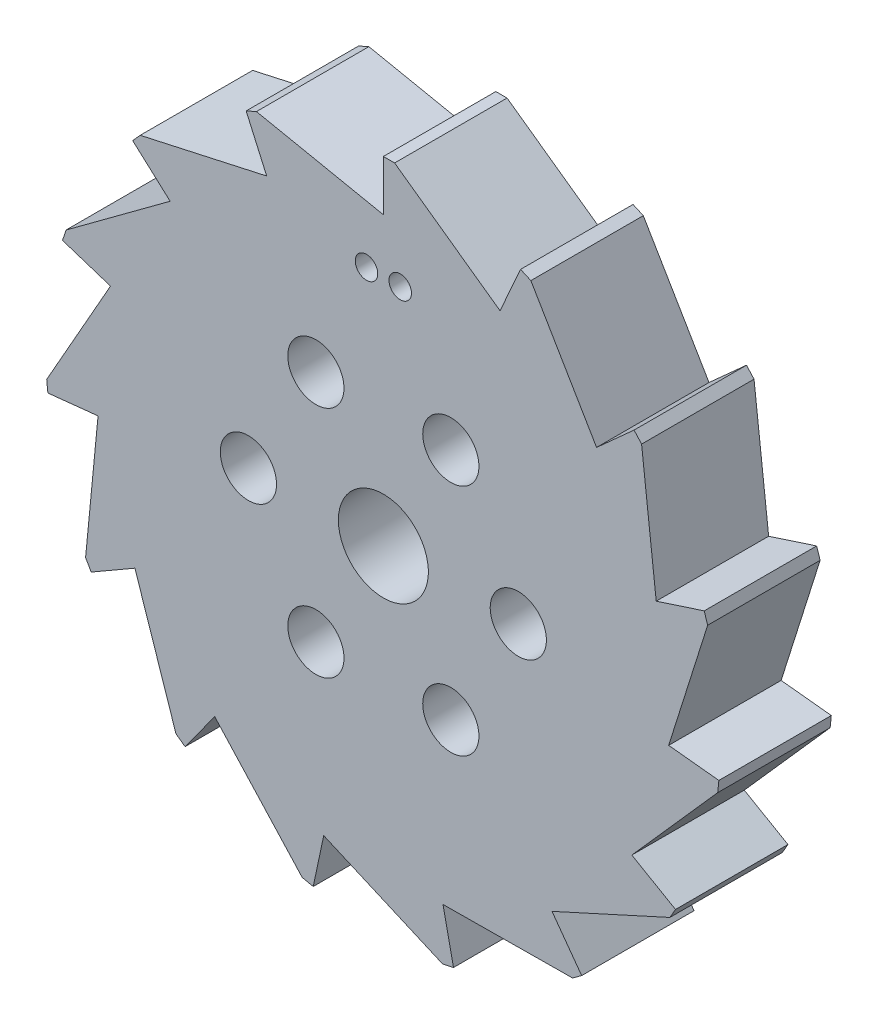
from build123d import *

# Parameters (mm, degrees)
BOSS_EXTRUDE2_DEPTH = 10
SKETCH2_R           = 4
SKETCH2_R_2         = 2.5
SKETCH2_R_3         = 1
CUT_EXTRUDE1_DEPTH  = 10


with BuildPart() as part:
    # Sketch1 → Boss-Extrude2 (new body)
    with BuildSketch(Plane.XY):
        Polygon((0, 25.51264103), (0, 30), (1.000891574, 30), (10.376925968, 23.306957325), (12.202099292, 27.406363729), (13.116459243, 26.99926445), (18.959587166, 17.071288962), (22.294344764, 20.073918191), (22.96407195, 19.330110797), (24.263963499, 7.88383965), (28.531695489, 9.270509831), (28.840987995, 8.318605378), (25.372880113, -2.666797161), (29.835656861, -3.135853898), (29.731035203, -4.131262483), (22.094595249, -12.756320515), (25.980762114, -15), (25.480316326, -15.86679753), (14.995954144, -20.640160164), (17.633557569, -24.270509831), (16.823819276, -24.858819138), (5.304376334, -24.955128612), (6.237350725, -29.344428022), (5.258331033, -29.552525082), (-5.304376334, -24.955128612), (-6.237350725, -29.344428022), (-7.216370416, -29.136330963), (-14.995954144, -20.640160164), (-17.633557569, -24.270509831), (-18.443295862, -23.682200525), (-22.094595249, -12.756320515), (-25.980762114, -15), (-26.481207901, -14.13320247), (-25.372880113, -2.666797161), (-29.835656861, -3.135853898), (-29.940278519, -2.140445313), (-24.263963499, 7.88383965), (-28.531695489, 9.270509831), (-28.222402983, 10.222414285), (-18.959587165, 17.071288962), (-22.294344764, 20.073918191), (-21.624617578, 20.817725585), (-10.376925968, 23.306957325), (-12.202099292, 27.406363729), (-11.287739341, 27.813463008), align=None)
    extrude(amount=BOSS_EXTRUDE2_DEPTH)

    # Sketch2 → Cut-Extrude1 (cut)
    with BuildSketch(Plane(origin=(0, 0, 0), x_dir=(-1, 0, 0), z_dir=(0, 0, -1))):
        Circle(SKETCH2_R)
        with Locations((-12, 0)):
            Circle(SKETCH2_R_2)
        with Locations((-6, 10.392304845)):
            Circle(SKETCH2_R_2)
        with Locations((6, 10.392304845)):
            Circle(SKETCH2_R_2)
        with Locations((12, 0)):
            Circle(SKETCH2_R_2)
        with Locations((6, -10.392304845)):
            Circle(SKETCH2_R_2)
        with Locations((-6, -10.392304845)):
            Circle(SKETCH2_R_2)
        with Locations((1.5, 20.714362339)):
            Circle(SKETCH2_R_3)
        with Locations((-1.5, 20.714362339)):
            Circle(SKETCH2_R_3)
    extrude(amount=-CUT_EXTRUDE1_DEPTH, mode=Mode.SUBTRACT)


solid = part.part
